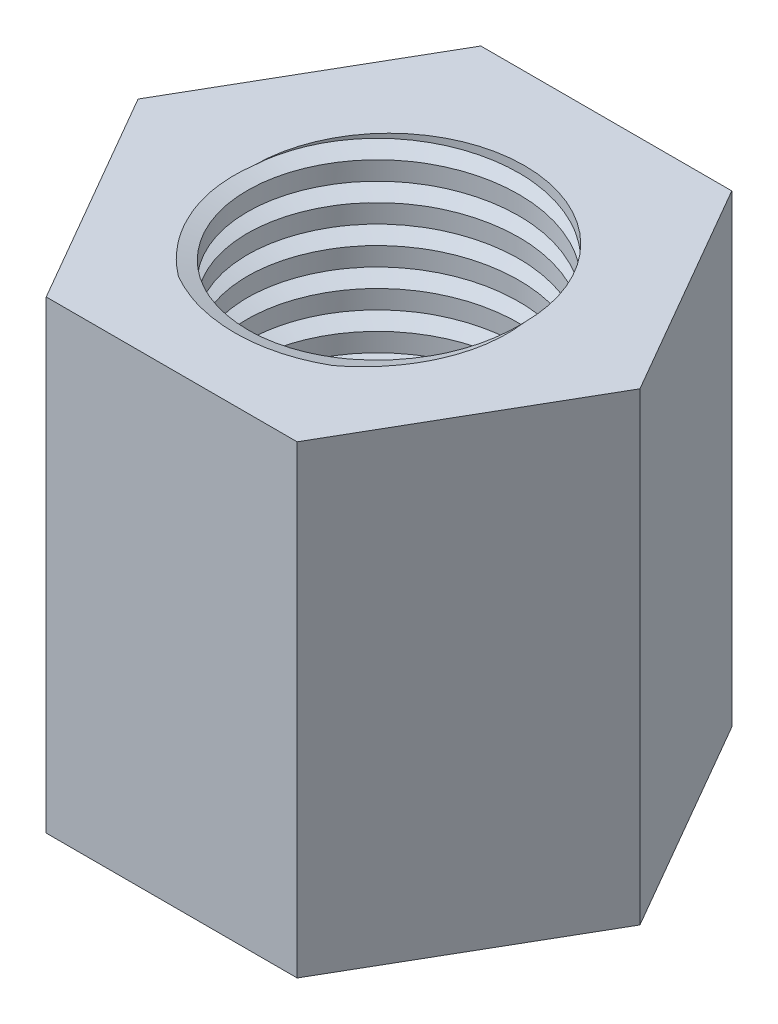
from build123d import *

# Parameters (mm, degrees)
SKETCH_1_R          = 1.46
EXTRUDE_1_DEPTH     = 5
SKETCH_1_3_R        = 1.46
CUT_EXTRUDE_1_DEPTH = 5
SWEEP_2_PITCH       = 0.4


with BuildPart() as part:
    # 草图1 → 凸台-拉伸1 (new body)
    # profile 1 of 2: a face of its own
    with BuildSketch(Plane(origin=(0, 0, 0), x_dir=(1, 0, 0), z_dir=(0, 1, 0))):
        Polygon((-2.70199926, 0), (-1.35099963, -2.34), (1.35099963, -2.34), (2.70199926, 0), (1.35099963, 2.34), (-1.35099963, 2.34), align=None)
        Circle(SKETCH_1_R, mode=Mode.SUBTRACT)
    # profile 2 of 2: a face of its own
    with BuildSketch(Plane(origin=(0, 0, 0), x_dir=(1, 0, 0), z_dir=(0, 1, 0))):
        Circle(SKETCH_1_R)
    extrude(amount=EXTRUDE_1_DEPTH)

    # 草图1<3> → 切除-拉伸1 (cut)
    with BuildSketch(Plane(origin=(0, 0, 0), x_dir=(1, 0, 0), z_dir=(0, 1, 0))):
        with Locations(Location((0, 0, 0), (0, 0, 270))):
            Circle(SKETCH_1_3_R)
    extrude(amount=CUT_EXTRUDE_1_DEPTH, mode=Mode.SUBTRACT)

    # 切除-扫描2: arcs per turn and ends read off the stored shape
    # 切除-扫描2: the profile of 草图7 profile screwed along a right-hand helix through 23.75 turns, 6 arcs to a turn; built about Z, then put on its axis
    sweep_2_z = Axis((0, 0, 0), (0, 0, 1))
    sweep_2_corners = [(1.4597, 0, 0.1001), (1.66, 0, 0.033333333), (1.66, 0, -0.033333333), (1.4597, 0, -0.1001)]
    with BuildLine(mode=Mode.PRIVATE) as sweep_2_profile:
        Line(sweep_2_corners[0], sweep_2_corners[1])
        Line(sweep_2_corners[1], sweep_2_corners[2])
        Line(sweep_2_corners[2], sweep_2_corners[3])
        Line(sweep_2_corners[3], sweep_2_corners[0])
    sweep_2_cap = Face(sweep_2_profile.wire())
    sweep_2_turn_angles = [0, 30, 60, 90, 120, 150, 180, 210, 240, 270, 300, 330, 360]
    sweep_2_turn_weights = [1, 0.8660254037844387, 1, 0.8660254037844387, 1, 0.8660254037844387, 1, 0.8660254037844387, 1, 0.8660254037844387, 1, 0.8660254037844387, 1]
    sweep_2_turn_rails = [Edge.make_bspline([Vector(p[0], p[1], 0).rotate(sweep_2_z, sweep_2_turn_angles[k]) / sweep_2_turn_weights[k] + Vector(0, 0, p[2] + SWEEP_2_PITCH * sweep_2_turn_angles[k] / 360) for k in range(13)], [0, 0, 0, 1, 1, 2, 2, 3, 3, 4, 4, 5, 5, 6, 6, 6], 2, sweep_2_turn_weights) for p in sweep_2_corners]
    sweep_2_turn_sides = [Face.make_surface_from_curves(sweep_2_turn_rails[p[0]], sweep_2_turn_rails[p[1]]) for p in [(0, 1), (1, 2), (2, 3), (3, 0)]]
    sweep_2_last_angles = [8280, 8310, 8340, 8370, 8400, 8430, 8460, 8490, 8520, 8535, 8550]
    sweep_2_last_weights = [1, 0.8660254037844387, 1, 0.8660254037844387, 1, 0.8660254037844387, 1, 0.8660254037844387, 1, 0.965925826289056, 1]
    sweep_2_last_rails = [Edge.make_bspline([Vector(p[0], p[1], 0).rotate(sweep_2_z, sweep_2_last_angles[k]) / sweep_2_last_weights[k] + Vector(0, 0, p[2] + SWEEP_2_PITCH * sweep_2_last_angles[k] / 360) for k in range(11)], [0, 0, 0, 1, 1, 2, 2, 3, 3, 4, 4, 5, 5, 5], 2, sweep_2_last_weights) for p in sweep_2_corners]
    sweep_2_last_sides = [Face.make_surface_from_curves(sweep_2_last_rails[p[0]], sweep_2_last_rails[p[1]]) for p in [(0, 1), (1, 2), (2, 3), (3, 0)]]
    sweep_2 = Plane(origin=(0, 0, 0), x_dir=(0, 0, -1), z_dir=(0, 1, 0)) * Solid(Shell([*[p.moved(Location((0, 0, SWEEP_2_PITCH * i))) for i in range(23) for p in sweep_2_turn_sides], *sweep_2_last_sides, sweep_2_cap, sweep_2_cap.rotate(sweep_2_z, 8550).moved(Location((0, 0, SWEEP_2_PITCH * 8550 / 360)))]))
    add(sweep_2, mode=Mode.SUBTRACT)


solid = part.part
